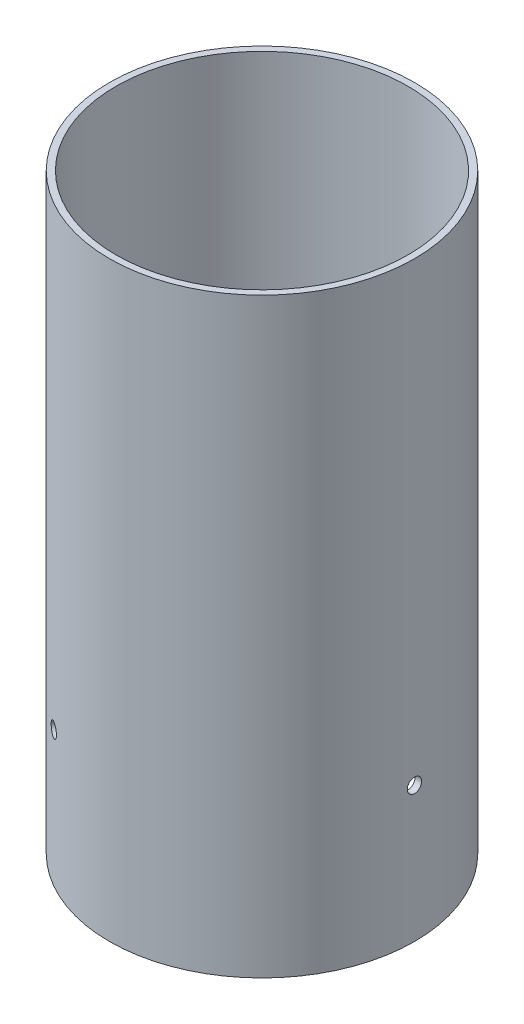
from build123d import *

# Parameters (mm, degrees)
SKETCH1_R           = 38.1381
SKETCH1_R_2         = 36.5125
BOSS_EXTRUDE1_DEPTH = 147.8153
CUT_EXTRUDE1_REACH  = 172.652
SKETCH2_R           = 1.7859375
CIRPATTERN1_COUNT   = 3


with BuildPart() as part:
    # Sketch1 → Boss-Extrude1 (new body)
    with BuildSketch(Plane(origin=(0, 0, 0), x_dir=(1, 0, 0), z_dir=(0, 1, 0))):
        Circle(SKETCH1_R)
        Circle(SKETCH1_R_2, mode=Mode.SUBTRACT)
    extrude(amount=BOSS_EXTRUDE1_DEPTH)

    # Sketch2 → Cut-Extrude1 (cut, up to next)
    with BuildSketch(Plane(origin=(38.1381, 0, 0), x_dir=(0, 0, -1), z_dir=(1, 0, 0)), mode=Mode.PRIVATE) as cut_extrude1_sk1:
        with Locations((0, 33.8074)):
            Circle(SKETCH2_R)
    cut_extrude1_tool1 = extrude(cut_extrude1_sk1.sketch, amount=-CUT_EXTRUDE1_REACH, mode=Mode.PRIVATE) & part.part
    cut_extrude1 = cut_extrude1_tool1.solids().sort_by_distance((38.1381, 33.8074, 0))[0]
    add(cut_extrude1, mode=Mode.SUBTRACT)

    # CirPattern1: Cut-Extrude1 ×3 about axis
    cirpattern1_axis = Axis((0, 155.08605, 0), (0, -1, 0))
    for i in range(1, CIRPATTERN1_COUNT):
        add(cut_extrude1.rotate(cirpattern1_axis, i * 360 / CIRPATTERN1_COUNT), mode=Mode.SUBTRACT)


solid = part.part
